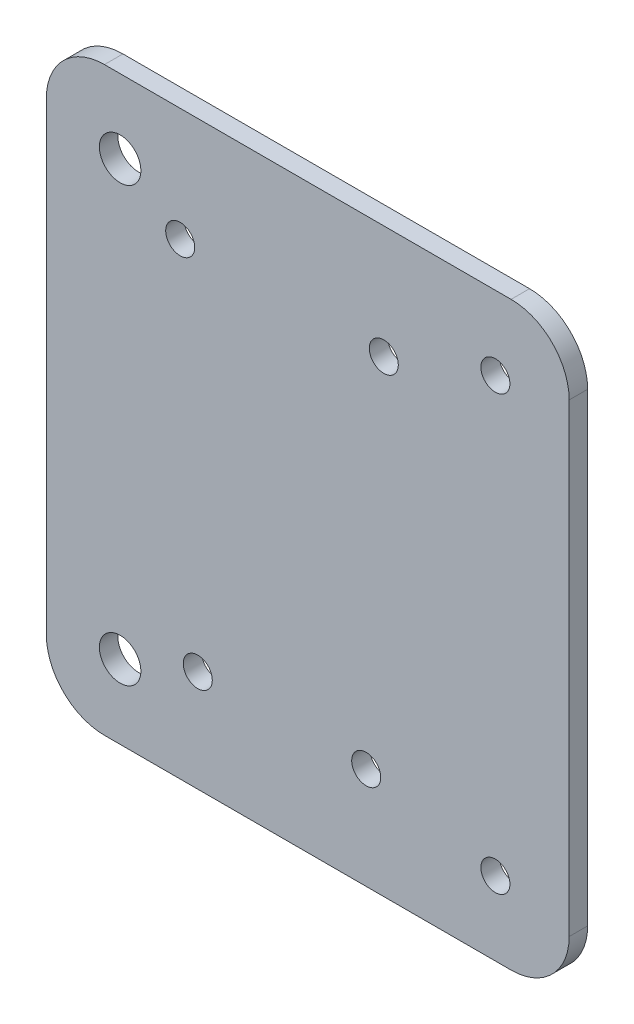
from build123d import *

# Parameters (mm, degrees)
SKETCH1_W           = 90
SKETCH1_H           = 100
SKETCH1_R           = 2.5
SKETCH1_R_2         = 3.57
BOSS_EXTRUDE1_DEPTH = 3.18
FILLET1_R           = 10
SKETCH2_R           = 2.5
CUT_EXTRUDE1_DEPTH  = 10


with BuildPart() as part:
    # Sketch1 → Boss-Extrude1 (new body)
    with BuildSketch(Plane.XY):
        with Locations((0, -5)):
            Rectangle(SKETCH1_W, SKETCH1_H)
        with Locations((32.3, -42.3)):
            Circle(SKETCH1_R, mode=Mode.SUBTRACT)
        with Locations((-32.3, -42.3)):
            Circle(SKETCH1_R_2, mode=Mode.SUBTRACT)
        with Locations((-32.3, 32.3)):
            Circle(SKETCH1_R_2, mode=Mode.SUBTRACT)
        with Locations((32.3, 32.3)):
            Circle(SKETCH1_R, mode=Mode.SUBTRACT)
    extrude(amount=-BOSS_EXTRUDE1_DEPTH)

    # Fillet1
    fillet1_edges = [part.edges().sort_by_distance(p)[0] for p in [
        (45, -55, -1.59),
        (-45, -55, -1.59),
        (-45, 45, -1.59),
        (45, 45, -1.59),
    ]]
    fillet(fillet1_edges, radius=FILLET1_R)

    # Sketch2 → Cut-Extrude1 (cut)
    with BuildSketch(Plane.XY):
        with Locations((-18.935439966, -37.5)):
            Circle(SKETCH2_R)
        with Locations((10.064560034, -37.5)):
            Circle(SKETCH2_R)
        with Locations((-21.9585864, 25.507758855)):
            Circle(SKETCH2_R)
        with Locations((13.087706469, 25.507758855)):
            Circle(SKETCH2_R)
    extrude(amount=-CUT_EXTRUDE1_DEPTH, mode=Mode.SUBTRACT)


solid = part.part
